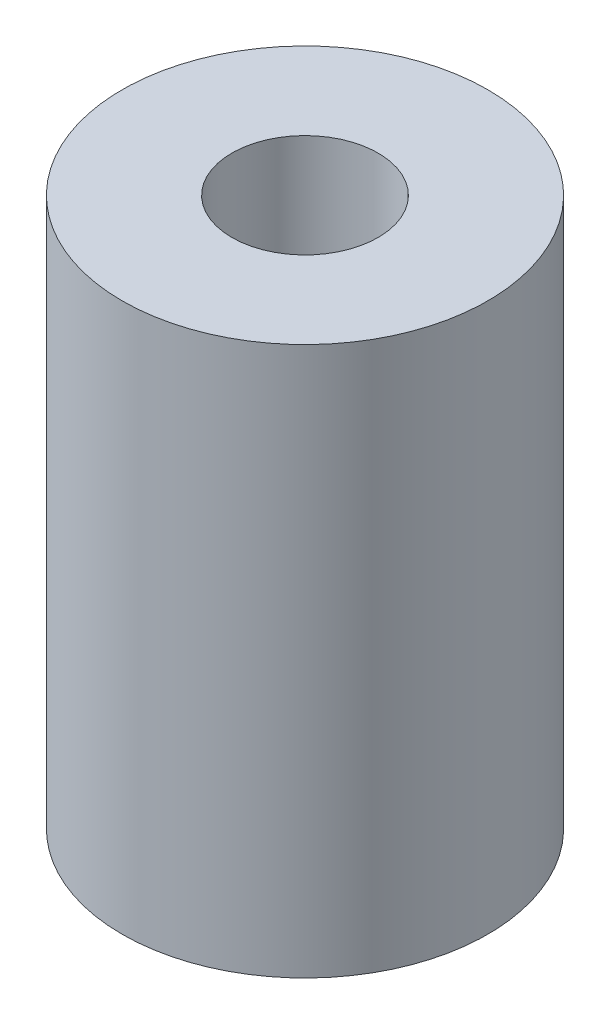
from build123d import *

# Parameters (mm, degrees)
SKETCH2_R           = 7.9375
SKETCH2_R_2         = 3.175
BOSS_EXTRUDE1_DEPTH = 23.8125


with BuildPart() as part:
    # Sketch2 → Boss-Extrude1 (new body)
    with BuildSketch(Plane(origin=(0, 0, 0), x_dir=(1, 0, 0), z_dir=(0, 1, 0))):
        Circle(SKETCH2_R)
        Circle(SKETCH2_R_2, mode=Mode.SUBTRACT)
    extrude(amount=BOSS_EXTRUDE1_DEPTH)


solid = part.part
